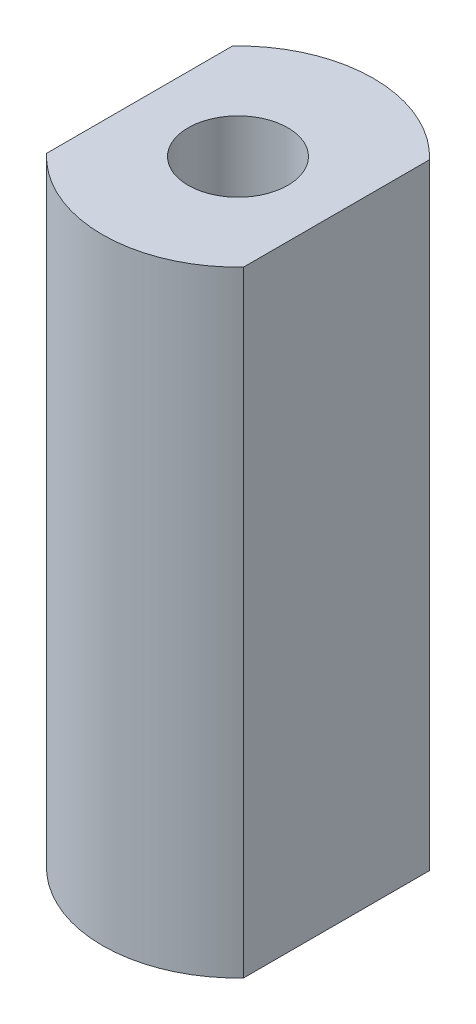
from build123d import *

# Parameters (mm, degrees)
SKETCH1_R           = 11
BOSS_EXTRUDE1_DEPTH = 50
SKETCH2_R           = 4.05
CUT_EXTRUDE1_DEPTH  = 53.364109846
SKETCH3_W           = 8.260489516
SKETCH3_H           = 24.670200022
SKETCH3_W_2         = 8.357068038
SKETCH3_H_2         = 23.787909513
CUT_EXTRUDE2_DEPTH  = 53.364109846


with BuildPart() as part:
    # Sketch1 → Boss-Extrude1 (new body)
    with BuildSketch(Plane(origin=(0, 0, 0), x_dir=(1, 0, 0), z_dir=(0, 1, 0))):
        Circle(SKETCH1_R)
    extrude(amount=BOSS_EXTRUDE1_DEPTH)

    # Sketch2 → Cut-Extrude1 (cut, through all)
    with BuildSketch(Plane(origin=(0, 50, 0), x_dir=(1, 0, 0), z_dir=(0, 1, 0))):
        Circle(SKETCH2_R)
    extrude(amount=-CUT_EXTRUDE1_DEPTH, mode=Mode.SUBTRACT)

    # Sketch3 → Cut-Extrude2 (cut, through all)
    with BuildSketch(Plane(origin=(0, 50, 0), x_dir=(1, 0, 0), z_dir=(0, 1, 0))):
        with Locations((-12.130244758, 1.085896012)):
            Rectangle(SKETCH3_W, SKETCH3_H)
        with Locations((12.178534019, 0.916224761)):
            Rectangle(SKETCH3_W_2, SKETCH3_H_2)
    extrude(amount=-CUT_EXTRUDE2_DEPTH, mode=Mode.SUBTRACT)


solid = part.part
